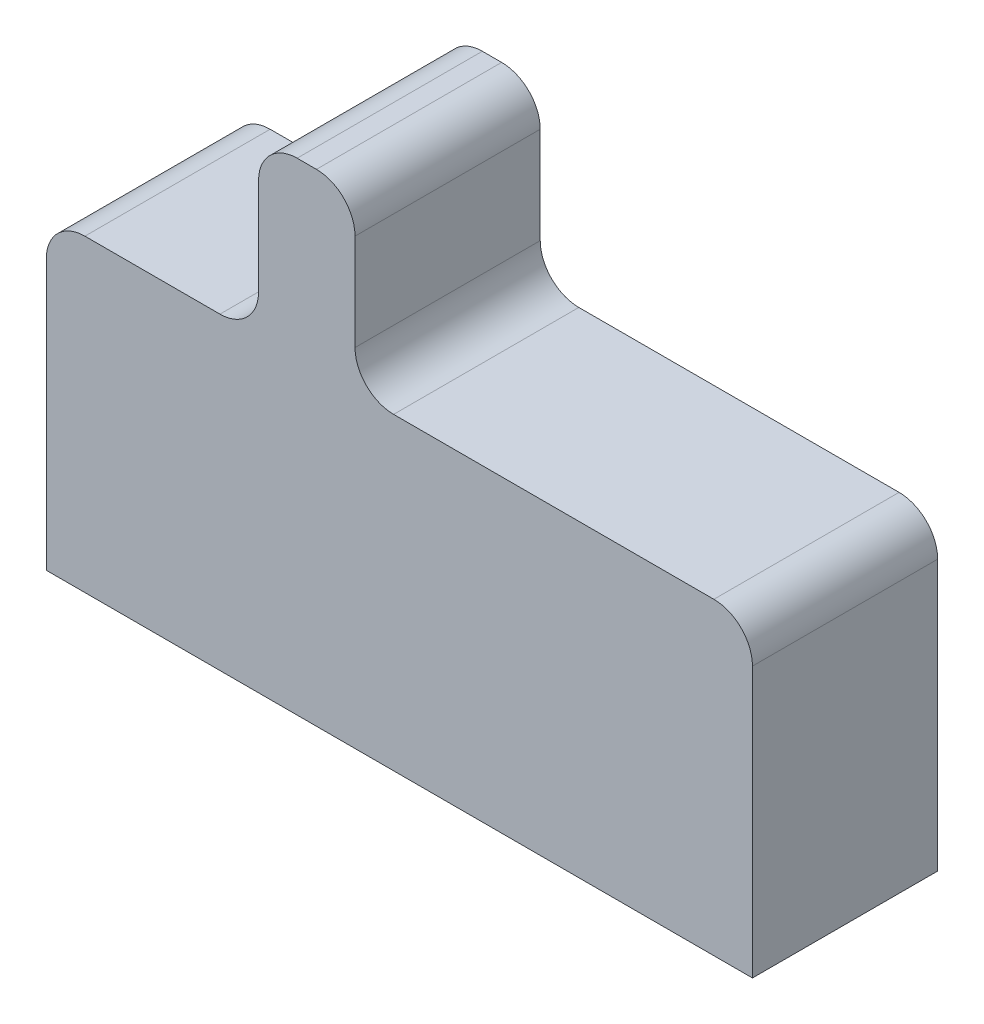
from build123d import *

# Parameters (mm, degrees)
BOSS_EXTRUDE1_DEPTH = 0.96
FILLET1_R           = 0.2


with BuildPart() as part:
    # Sketch1 → Boss-Extrude1 (new body)
    with BuildSketch(Plane.XY):
        Polygon((-0.73, 0.8), (-0.73, 1.7), (-0.23, 1.7), (-0.23, 0.8), (1.83, 0.8), (1.83, -0.8), (-1.83, -0.8), (-1.83, 0.8), align=None)
    extrude(amount=BOSS_EXTRUDE1_DEPTH)

    # Fillet1
    fillet1_edges = [part.edges().sort_by_distance(p)[0] for p in [
        (-0.73, 0.8, 0.48),
        (-0.23, 0.8, 0.48),
        (-0.23, 1.7, 0.48),
        (-0.73, 1.7, 0.48),
        (1.83, 0.8, 0.48),
        (-1.83, 0.8, 0.48),
    ]]
    fillet(fillet1_edges, radius=FILLET1_R)


solid = part.part
